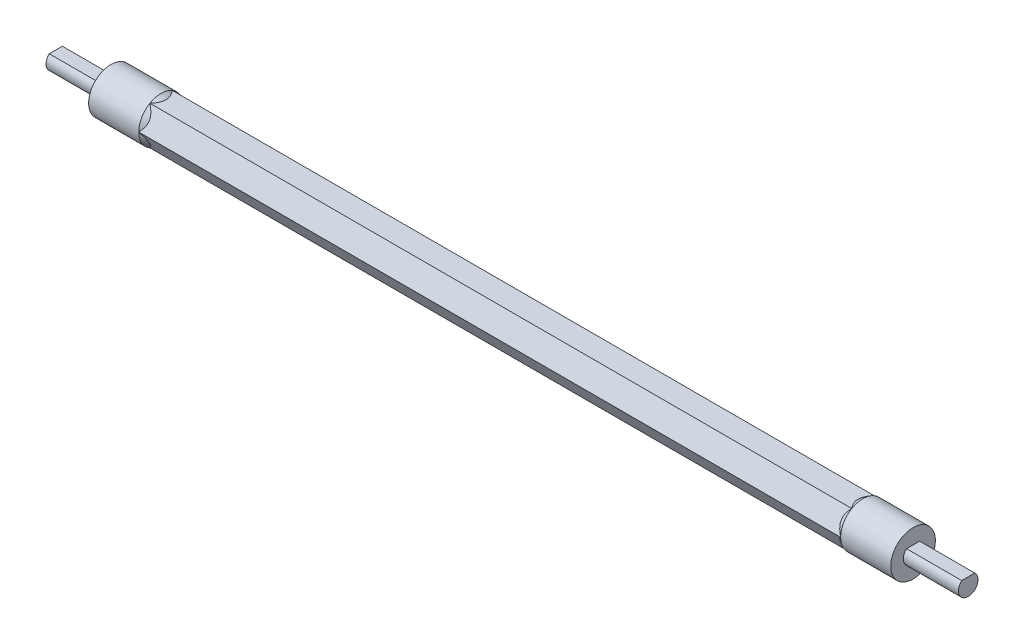
from build123d import *

# Parameters (mm, degrees)
BOSS_EXTRUDE1_DEPTH = 70
BOSS_EXTRUDE2_START = 70
SKETCH1_3_R         = 4.45
BOSS_EXTRUDE2_DEPTH = 10
BOSS_EXTRUDE4_DEPTH = 11


with BuildPart() as part:
    # Sketch1 → Boss-Extrude1 (new, symmetric)
    with BuildSketch(Plane(origin=(0, 0, 0), x_dir=(0, 0, -1), z_dir=(1, 0, 0))):
        Polygon((2.225, -3.853813047), (4.45, 0), (2.225, 3.853813047), (-2.225, 3.853813047), (-4.45, 0), (-2.225, -3.853813047), align=None)
    extrude(amount=BOSS_EXTRUDE1_DEPTH, both=True)

    # Sketch1<3> → Boss-Extrude2 (add)
    with BuildSketch(Plane(origin=(0, 0, 0), x_dir=(0, 0, -1), z_dir=(1, 0, 0)).offset(BOSS_EXTRUDE2_START)):
        Circle(SKETCH1_3_R)
    boss_extrude2 = extrude(amount=BOSS_EXTRUDE2_DEPTH)

    # Sketch4 → Boss-Extrude4 (add)
    with BuildSketch(Plane(origin=(80, 0, 0), x_dir=(0, 0, -1), z_dir=(1, 0, 0))):
        with BuildLine():
            Line((1.303840481, 1.45), (-1.303840481, 1.45))
            ThreePointArc((-1.303840481, 1.45), (-0.793728878, -1.78114976), (1.95, 0))
            ThreePointArc((1.95, 0), (1.78114976, 0.793728878), (1.303840481, 1.45))
        make_face()
    boss_extrude4 = extrude(amount=BOSS_EXTRUDE4_DEPTH)

    # Sketch5 → Revolve1 (revolve)
    with BuildSketch(Plane.XY):
        Polygon((70, 4.45), (69, 3.853813047), (69, 0), (70, 0), align=None)
    revolve1 = revolve(axis=Axis((69, 0, 0), (1, 0, 0)))

    # Mirror3: Boss-Extrude2, Boss-Extrude4, Revolve1 across plane
    add(boss_extrude2.mirror(Plane(origin=(0, 0, 0), x_dir=(0, 0, 1), z_dir=(1, 0, 0))))
    add(boss_extrude4.mirror(Plane(origin=(0, 0, 0), x_dir=(0, 0, 1), z_dir=(1, 0, 0))))
    add(revolve1.mirror(Plane(origin=(0, 0, 0), x_dir=(0, 0, 1), z_dir=(1, 0, 0))))


solid = part.part
